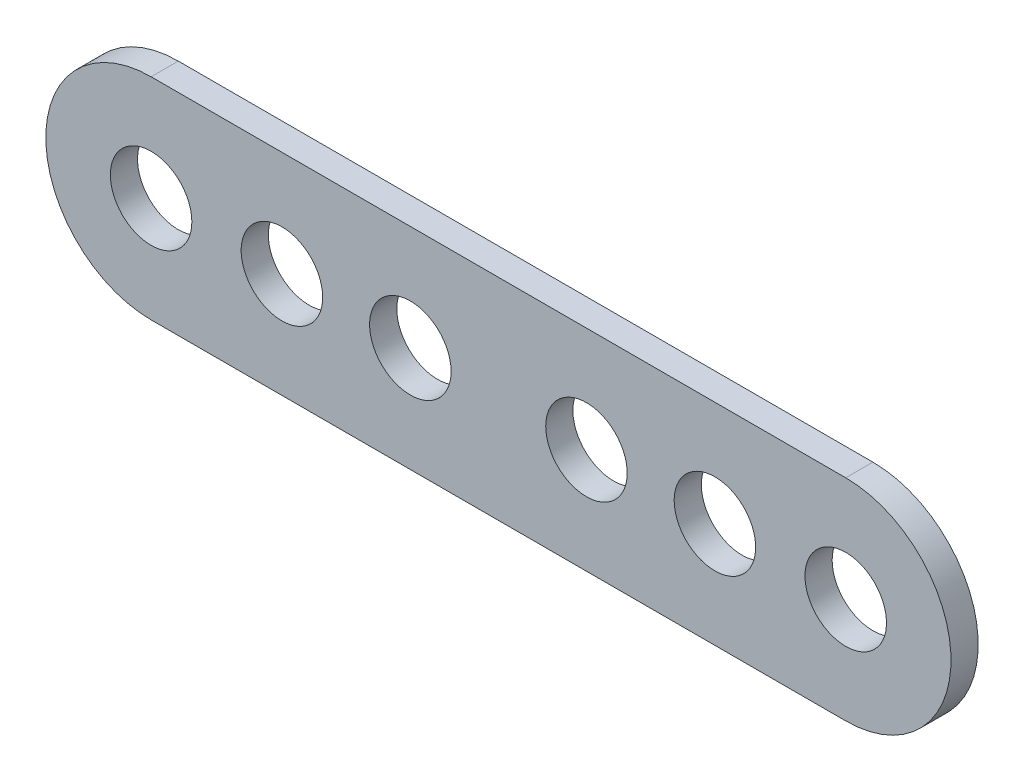
from build123d import *

# Parameters (mm, degrees)
SKETCH_1_R      = 3
EXTRUDE_1_DEPTH = 2


with BuildPart() as part:
    # Эскиз1 → Бобышка-Вытянуть1 (new body)
    with BuildSketch(Plane.XY):
        with BuildLine():
            Line((25.56814985, 7.75), (-25.56814985, 7.75))
            ThreePointArc((-25.56814985, 7.75), (-33.31814985, 0), (-25.56814985, -7.75))
            Line((-25.56814985, -7.75), (25.56814985, -7.75))
            ThreePointArc((25.56814985, -7.75), (33.31814985, 0), (25.56814985, 7.75))
        make_face()
        with Locations((-25.56814985, 0)):
            Circle(SKETCH_1_R, mode=Mode.SUBTRACT)
        with Locations((-15.937574019, 0)):
            Circle(SKETCH_1_R, mode=Mode.SUBTRACT)
        with Locations((-6.482099566, 0)):
            Circle(SKETCH_1_R, mode=Mode.SUBTRACT)
        with Locations((6.482099566, 0)):
            Circle(SKETCH_1_R, mode=Mode.SUBTRACT)
        with Locations((15.937574019, 0)):
            Circle(SKETCH_1_R, mode=Mode.SUBTRACT)
        with Locations((25.56814985, 0)):
            Circle(SKETCH_1_R, mode=Mode.SUBTRACT)
    extrude(amount=EXTRUDE_1_DEPTH)


solid = part.part
